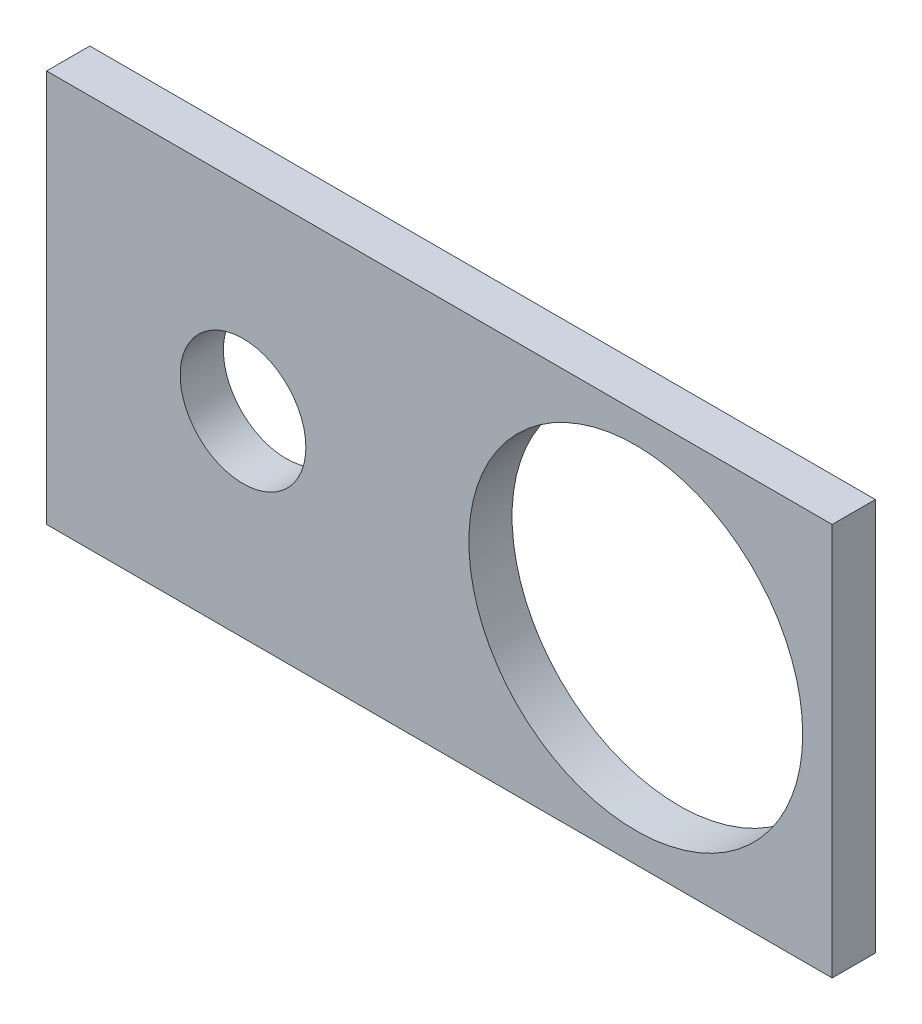
from build123d import *

# Parameters (mm, degrees)
ESQUISSE1_W        = 200
ESQUISSE1_H        = 100
ESQUISSE1_R        = 42.5
ESQUISSE1_R_2      = 16
BOSS_EXTRU_1_DEPTH = 11


with BuildPart() as part:
    # Esquisse1 → Boss.-Extru.1 (new body)
    with BuildSketch(Plane.XY):
        with Locations((-50, 0)):
            Rectangle(ESQUISSE1_W, ESQUISSE1_H)
        Circle(ESQUISSE1_R, mode=Mode.SUBTRACT)
        with Locations((-100, 0)):
            Circle(ESQUISSE1_R_2, mode=Mode.SUBTRACT)
    extrude(amount=BOSS_EXTRU_1_DEPTH)


solid = part.part
